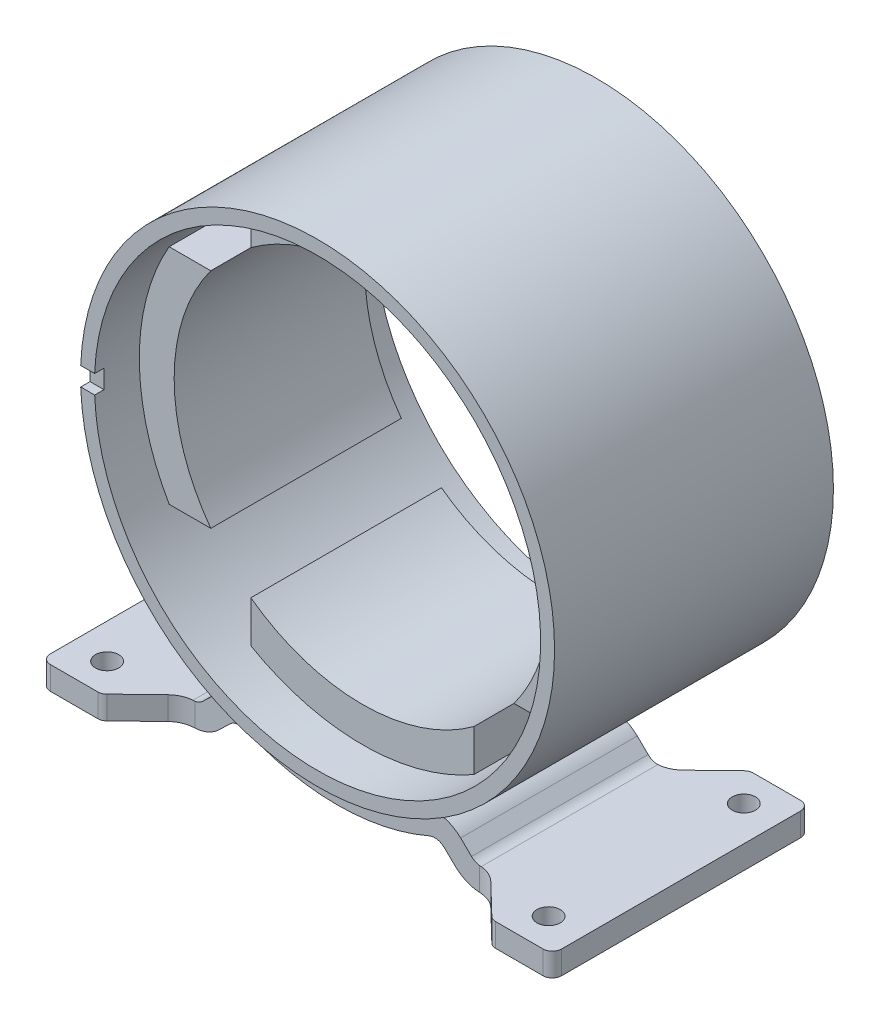
from build123d import *

# Parameters (mm, degrees)
ESQUISSE1_R                = 51
ESQUISSE1_R_2              = 48
BOSS_EXTRU_1_DEPTH         = 60
BOSS_EXTRU_2_START         = 9.35
BOSS_EXTRU_2_DEPTH         = 41
BOSS_EXTRU_3_START         = 9.08
BOSS_EXTRU_3_DEPTH         = 55.4
ENL_V_MAT_EXTRU_1_DEPTH    = 103.415430478
CONG_1_R                   = 2
CONG_2_R                   = 6
ESQUISSE9_W                = 2.5
ESQUISSE9_H                = 50.589862519
TROU_TARAUD_M61_AT_2_COUNT = 2
TROU_TARAUD_M61_AT_2_PITCH = 42
TROU_TARAUD_M61_AT_3_COUNT = 2
TROU_TARAUD_M61_AT_3_PITCH = 103.870111197
TROU_TARAUD_M61_AT_4_COUNT = 2
TROU_TARAUD_M61_AT_4_PITCH = 95
CHANFREIN1_SIZE            = 0.5
ESQUISSE6_W                = 3.041684767
ESQUISSE6_H                = 4
ENL_V_MAT_EXTRU_2_DEPTH    = 2
ESQUISSE7_W                = 3.041684767
ESQUISSE7_H                = 4
ENL_V_MAT_EXTRU_3_DEPTH    = 2.5


with BuildPart() as part:
    # Esquisse1 → Boss.-Extru.1 (new body)
    with BuildSketch(Plane.XY):
        Circle(ESQUISSE1_R)
        Circle(ESQUISSE1_R_2, mode=Mode.SUBTRACT)
    extrude(amount=BOSS_EXTRU_1_DEPTH)

    # Esquisse3 → Boss.-Extru.2 (add)
    with BuildSketch(Plane.XY.offset(BOSS_EXTRU_2_START)):
        with BuildLine():
            Line((-41.569219382, 24), (-32.622844756, 24))
            ThreePointArc((-32.622844756, 24), (-40.5, 0), (-32.622844756, -24))
            Line((-32.622844756, -24), (-41.569219382, -24))
            ThreePointArc((-41.569219382, -24), (-48, 0), (-41.569219382, 24))
        make_face()
        with BuildLine():
            Line((-24, 41.569219382), (-24, 32.622844756))
            ThreePointArc((-24, 32.622844756), (0, 40.5), (24, 32.622844756))
            Line((24, 32.622844756), (24, 41.569219382))
            ThreePointArc((24, 41.569219382), (0, 48), (-24, 41.569219382))
        make_face()
        with BuildLine():
            Line((32.622844756, 24), (41.569219382, 24))
            ThreePointArc((41.569219382, 24), (48, 0), (41.569219382, -24))
            Line((41.569219382, -24), (32.622844756, -24))
            ThreePointArc((32.622844756, -24), (40.5, 0), (32.622844756, 24))
        make_face()
        with BuildLine():
            Line((24, -32.622844756), (24, -41.569219382))
            ThreePointArc((24, -41.569219382), (0, -48), (-24, -41.569219382))
            Line((-24, -41.569219382), (-24, -32.622844756))
            ThreePointArc((-24, -32.622844756), (0, -40.5), (24, -32.622844756))
        make_face()
    extrude(amount=BOSS_EXTRU_2_DEPTH)

    # Esquisse6 → Enlèv. mat.-Extru.2 (cut)
    with BuildSketch(Plane.XY.offset(60)):
        with Locations((-49.479157617, 0)):
            Rectangle(ESQUISSE6_W, ESQUISSE6_H)
    extrude(amount=-ENL_V_MAT_EXTRU_2_DEPTH, mode=Mode.SUBTRACT)

    # Esquisse7 → Enlèv. mat.-Extru.3 (cut)
    with BuildSketch(Plane(origin=(0, 0, 0), x_dir=(-1, 0, 0), z_dir=(0, 0, -1))):
        with Locations((49.479157617, 0)):
            Rectangle(ESQUISSE7_W, ESQUISSE7_H)
    extrude(amount=-ENL_V_MAT_EXTRU_3_DEPTH, mode=Mode.SUBTRACT)


with BuildPart() as body_2:
    # Esquisse4 → Boss.-Extru.3 (new body)
    with BuildSketch(Plane.XY.offset(BOSS_EXTRU_3_START)):
        with BuildLine():
            Line((28.911557572, -51.653520397), (26.569302339, -49.382232214))
            ThreePointArc((26.569302339, -49.382232214), (22.42935699, -47.25409711), (17.805503879, -47.790836272))
            ThreePointArc((17.805503879, -47.790836272), (0, -51.5), (-17.805503879, -47.790836272))
            ThreePointArc((-17.805503879, -47.790836272), (-22.42935699, -47.25409711), (-26.569302339, -49.382232214))
            Line((-26.569302339, -49.382232214), (-28.911557572, -51.653520397))
            ThreePointArc((-28.911557572, -51.653520397), (-29.873298892, -52.280209683), (-31, -52.499823988))
            Line((-31, -52.499823988), (-55, -52.499823988))
            Line((-55, -52.499823988), (-55, -57.5))
            Line((-55, -57.5), (-31, -57.5))
            ThreePointArc((-31, -57.5), (-27.995397608, -56.914348969), (-25.430697661, -55.243140772))
            Line((-25.430697661, -55.243140772), (-23.088442428, -52.971852588))
            ThreePointArc((-23.088442428, -52.971852588), (-21.535997078, -52.173819482), (-19.802090311, -52.37509224))
            ThreePointArc((-19.802090311, -52.37509224), (0, -56.500176012), (19.802090311, -52.37509224))
            ThreePointArc((19.802090311, -52.37509224), (21.535997078, -52.173819482), (23.088442428, -52.971852588))
            Line((23.088442428, -52.971852588), (25.430697661, -55.243140772))
            ThreePointArc((25.430697661, -55.243140772), (27.995397608, -56.914348969), (31, -57.5))
            Line((31, -57.5), (55, -57.5))
            Line((55, -57.5), (55, -52.499823988))
            Line((55, -52.499823988), (31, -52.499823988))
            ThreePointArc((31, -52.499823988), (29.873298892, -52.280209683), (28.911557572, -51.653520397))
        make_face()
    extrude(amount=BOSS_EXTRU_3_DEPTH)

    # Esquisse5 → Enlèv. mat.-Extru.1 (cut, through all)
    with BuildSketch(Plane(origin=(0, 0, 0), x_dir=(1, 0, 0), z_dir=(0, 1, 0))):
        Polygon((-33, -17.78), (33, -17.78), (42, -9.08), (-42, -9.08), align=None)
        Polygon((-42, -64.48), (42, -64.48), (33, -55.78), (-33, -55.78), align=None)
    extrude(amount=-ENL_V_MAT_EXTRU_1_DEPTH, mode=Mode.SUBTRACT)

    # Congé1
    cong_1_edges = [body_2.edges().sort_by_distance(p)[0] for p in [
        (42, -54.999911994, 64.48),
        (55, -54.999911994, 64.48),
        (55, -54.999911994, 9.08),
        (42, -54.999911994, 9.08),
        (-42, -54.999911994, 9.08),
        (-55, -54.999911994, 9.08),
        (-55, -54.999911994, 64.48),
        (-42, -54.999911994, 64.48),
    ]]
    fillet(cong_1_edges, radius=CONG_1_R)

    # Congé2
    cong_2_edges = [body_2.edges().sort_by_distance(p)[0] for p in [
        (33, -54.999911994, 17.78),
    ]]
    fillet(cong_2_edges, radius=CONG_2_R)
    cong_2_2_edges = [body_2.edges().sort_by_distance(p)[0] for p in [
        (-33, -54.999911994, 17.78),
    ]]
    fillet(cong_2_2_edges, radius=CONG_2_R)
    cong_2_3_edges = [body_2.edges().sort_by_distance(p)[0] for p in [
        (-33, -54.999911994, 55.78),
    ]]
    fillet(cong_2_3_edges, radius=CONG_2_R)
    cong_2_4_edges = [body_2.edges().sort_by_distance(p)[0] for p in [
        (33, -54.999911994, 55.78),
    ]]
    fillet(cong_2_4_edges, radius=CONG_2_R)

    # Esquisse9 → Trou taraudé M61 (revolve, cut)
    with BuildSketch(Plane(origin=(-47.5, -57.5, 57.78), x_dir=(0, 0, -1), z_dir=(1, 0, 0))):
        with Locations((1.25, 25.29493126)):
            Rectangle(ESQUISSE9_W, ESQUISSE9_H)
    trou_taraud_m61 = revolve(axis=Axis((-47.5, -63.85, 57.78), (0, 1, 0)), mode=Mode.SUBTRACT)

    # Trou taraudé M61 at 2: Trou taraudé M61 ×2
    with Locations(*[(0, 0, -i * TROU_TARAUD_M61_AT_2_PITCH) for i in range(1, TROU_TARAUD_M61_AT_2_COUNT)]):
        add(trou_taraud_m61, mode=Mode.SUBTRACT)

    # Trou taraudé M61 at 3: Trou taraudé M61 ×2
    with Locations(*[Vector(0.9146038153378182, 0, -0.4043511604651409) * (i * TROU_TARAUD_M61_AT_3_PITCH) for i in range(1, TROU_TARAUD_M61_AT_3_COUNT)]):
        add(trou_taraud_m61, mode=Mode.SUBTRACT)

    # Trou taraudé M61 at 4: Trou taraudé M61 ×2
    with Locations(*[(i * TROU_TARAUD_M61_AT_4_PITCH, 0, 0) for i in range(1, TROU_TARAUD_M61_AT_4_COUNT)]):
        add(trou_taraud_m61, mode=Mode.SUBTRACT)

    # Chanfrein1
    chanfrein1_edges = [body_2.edges().sort_by_distance(p)[0] for p in [
        (-47.5, -57.5, 18.28),
        (-47.5, -57.5, 60.28),
        (47.5, -57.5, 60.28),
        (47.5, -57.5, 18.28),
    ]]
    chamfer(chanfrein1_edges, length=CHANFREIN1_SIZE)


solid = Compound([part.part, body_2.part])
